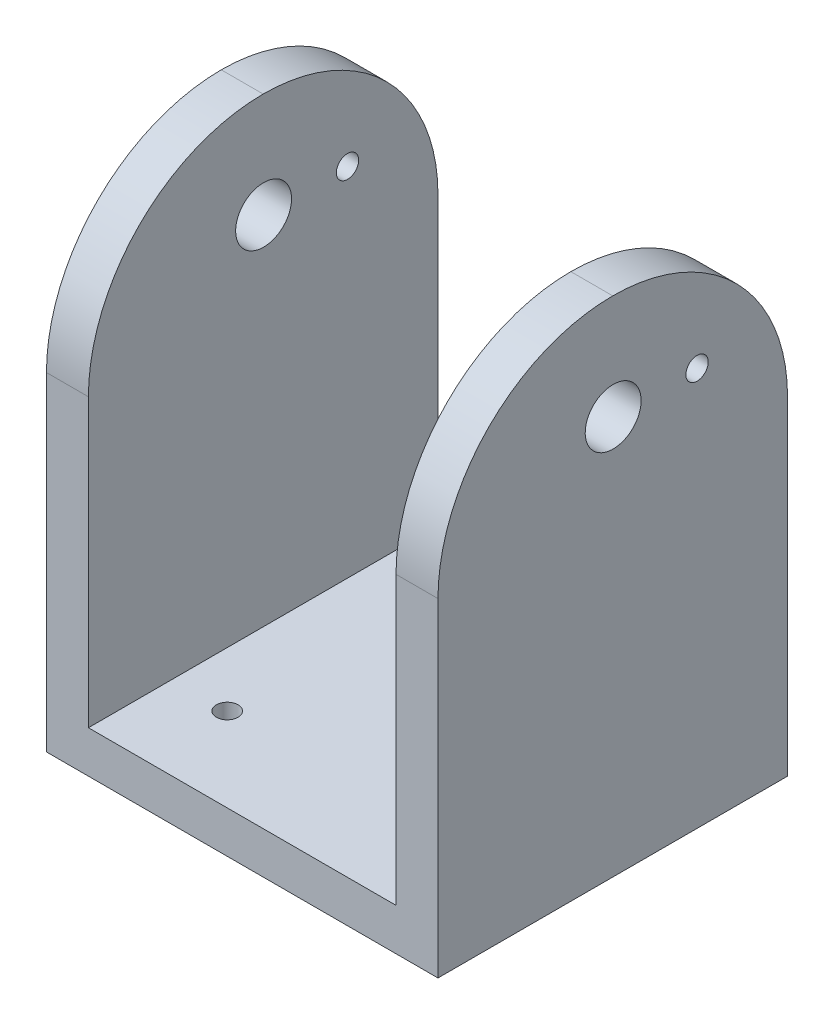
from build123d import *

# Parameters (mm, degrees)
SKETCH1_W           = 6
SKETCH1_H           = 66
SKETCH1_W_2         = 44
SKETCH1_H_2         = 6
BOSS_EXTRUDE1_DEPTH = 50
FILLET1_R           = 25
SKETCH3_R           = 1.6
SKETCH3_R_2         = 4
CUT_EXTRUDE2_DEPTH  = 88.527138649
SKETCH4_R           = 1.55
CUT_EXTRUDE3_DEPTH  = 88.407093534


with BuildPart() as part:
    # Sketch1 → Boss-Extrude1 (new body)
    with BuildSketch(Plane.XY):
        with Locations((-25, 12)):
            Rectangle(SKETCH1_W, SKETCH1_H)
        with Locations((0, -24)):
            Rectangle(SKETCH1_W_2, SKETCH1_H_2)
        with Locations((-25, -24)):
            Rectangle(SKETCH1_W, SKETCH1_H_2)
        with Locations((25, -24)):
            Rectangle(SKETCH1_W, SKETCH1_H_2)
        with Locations((25, 12)):
            Rectangle(SKETCH1_W, SKETCH1_H)
    extrude(amount=BOSS_EXTRUDE1_DEPTH)

    # Fillet1
    fillet1_edges = [part.edges().sort_by_distance(p)[0] for p in [
        (-25, 45, 50),
        (-25, 45, 0),
        (25, 45, 0),
        (25, 45, 50),
    ]]
    fillet(fillet1_edges, radius=FILLET1_R - 0.0001)  # a hair under: the kernel refuses the full size

    # Sketch3 → Cut-Extrude2 (cut, through all)
    with BuildSketch(Plane(origin=(28, 0, 0), x_dir=(0, 0, -1), z_dir=(1, 0, 0))):
        with Locations(Location((-12.941245902, 30, 0), (0, 0, 90))):
            Circle(SKETCH3_R)
        with Locations(Location((-24.941245902, 30, 0), (0, 0, 90))):
            Circle(SKETCH3_R_2)
    extrude(amount=-CUT_EXTRUDE2_DEPTH, mode=Mode.SUBTRACT)

    # Sketch4 → Cut-Extrude3 (cut, through all)
    with BuildSketch(Plane(origin=(0, -21, 0), x_dir=(1, 0, 0), z_dir=(0, 1, 0))):
        with Locations(Location((-14.142135624, -38, 0), (0, 0, 270))):
            Circle(SKETCH4_R)
        with Locations(Location((14.142135624, -38, 0), (0, 0, 270))):
            Circle(SKETCH4_R)
        with Locations(Location((0, -13, 0), (0, 0, 270))):
            Circle(SKETCH4_R)
    extrude(amount=-CUT_EXTRUDE3_DEPTH, mode=Mode.SUBTRACT)


solid = part.part
